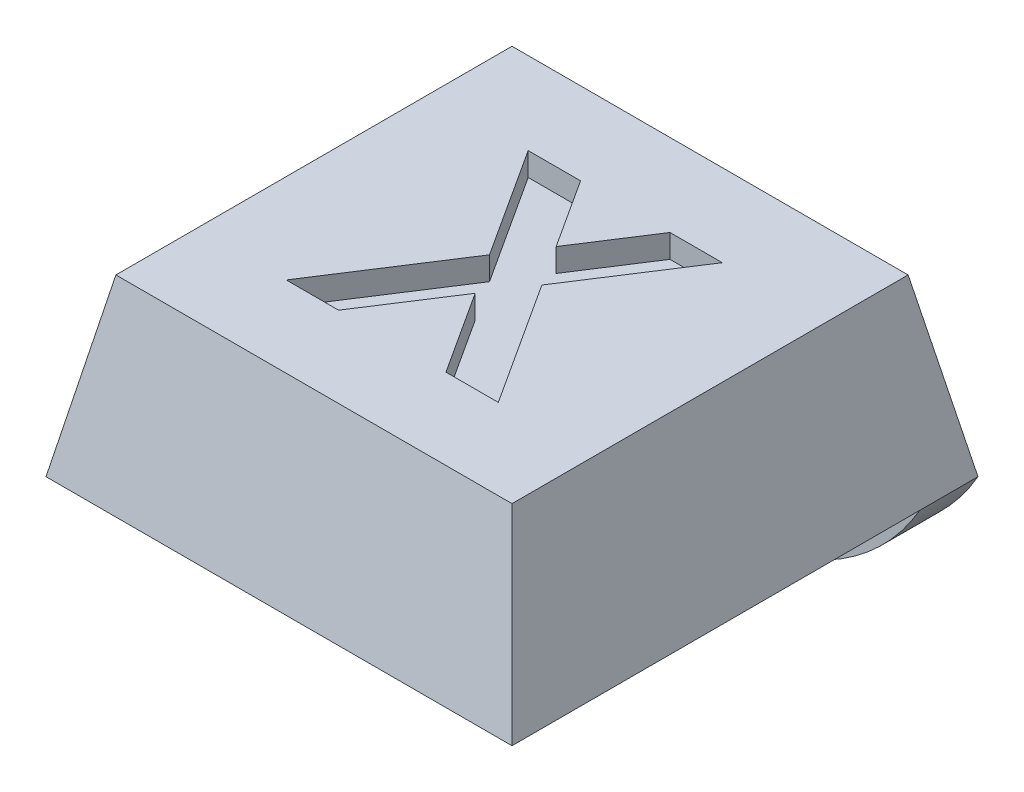
from build123d import *

# Parameters (mm, degrees)
SKETCH1_W               = 8
SKETCH1_H               = 8
BOSS_EXTRUDE1_DEPTH     = 3
CUT_EXTRUDE1_DEPTH      = 12.704699911
CUT_EXTRUDE1_DEPTH_BACK = 12.704699911
CUT_EXTRUDE2_DEPTH      = 11
SKETCH4_R               = 1.75
CUT_EXTRUDE3_DEPTH      = 0.4
SKETCH5_W               = 8
SKETCH5_H               = 1
BOSS_EXTRUDE2_DEPTH     = 2
FILLET1_R               = 4
CUT_EXTRUDE4_DEPTH      = 0.4


with BuildPart() as part:
    # Sketch1 → Boss-Extrude1 (new body)
    with BuildSketch(Plane(origin=(0, 0, 0), x_dir=(1, 0, 0), z_dir=(0, 1, 0))):
        with Locations((4, 4)):
            Rectangle(SKETCH1_W, SKETCH1_H)
    extrude(amount=BOSS_EXTRUDE1_DEPTH)

    # Sketch2 → Cut-Extrude1 (cut, two sides: drawn at the far end of the back side and taken through both)
    with BuildSketch(Plane.XY.offset(-CUT_EXTRUDE1_DEPTH_BACK)):
        Polygon((0, 0), (0.6, 3), (0, 3), align=None)
        Polygon((8, 0), (7.4, 3), (8, 3), align=None)
    extrude(amount=CUT_EXTRUDE1_DEPTH + CUT_EXTRUDE1_DEPTH_BACK, mode=Mode.SUBTRACT)

    # Sketch3 → Cut-Extrude2 (cut)
    with BuildSketch(Plane(origin=(0, 0, 0), x_dir=(0, 0, -1), z_dir=(1, 0, 0))):
        Polygon((0, 0), (0.6, 3), (0, 3), align=None)
        Polygon((8, 3), (7.4, 3), (8, 0), align=None)
    extrude(amount=CUT_EXTRUDE2_DEPTH, mode=Mode.SUBTRACT)

    # Sketch4 → Cut-Extrude3 (cut)
    with BuildSketch(Plane.XZ):
        with Locations(Location((4, -3.75, 0), (0, 0, 270))):
            Circle(SKETCH4_R)
    extrude(amount=-CUT_EXTRUDE3_DEPTH, mode=Mode.SUBTRACT)

    # Sketch5 → Boss-Extrude2 (add)
    with BuildSketch(Plane.XZ):
        with Locations((4, -7.5)):
            Rectangle(SKETCH5_W, SKETCH5_H)
    extrude(amount=BOSS_EXTRUDE2_DEPTH)

    # Fillet1
    # the kernel refuses this fillet: 4 mm, written as the material it takes off along each edge
    with BuildSketch(Plane(origin=(8, -2, -16.660254038), x_dir=(0, 1, 0), z_dir=(0, 0, 1)), Plane(origin=(0, -2, 1.660254038), x_dir=(0, 1, 0), z_dir=(0, 0, -1))) as fillet1_piece_1:
        with BuildLine():
            CenterArc((4, 3.464101615), FILLET1_R, 180, 60)
            Line((0, 3.464101615), (-0.08, 3.464101615))
            Line((-0.08, 3.464101615), (-0.08, 0))
            Line((-0.08, 0), (0, -0.08))
            ThreePointArc((0, -0.08), (1, -0.08), (1.96, -0.069282032))
            Line((1.96, -0.069282032), (2, 0))
        make_face()
    extrude(amount=18.320508076, mode=Mode.SUBTRACT)

    # Sketch6 → Cut-Extrude4 (cut)
    with BuildSketch(Plane(origin=(0, 3, 0), x_dir=(1, 0, 0), z_dir=(0, 1, 0))):
        Polygon((2.136477101, 1.987434605), (3.507470691, 4.106024349), (2.290323255, 5.987434605), (3.189361717, 5.987434605), (3.956989922, 4.800735887), (4.724618127, 5.987434605), (5.623656589, 5.987434605), (4.406509153, 4.106024349), (5.777502742, 1.987434605), (4.878464281, 1.987434605), (3.956989922, 3.41131281), (3.035515563, 1.987434605), align=None)
    extrude(amount=-CUT_EXTRUDE4_DEPTH, mode=Mode.SUBTRACT)


solid = part.part
